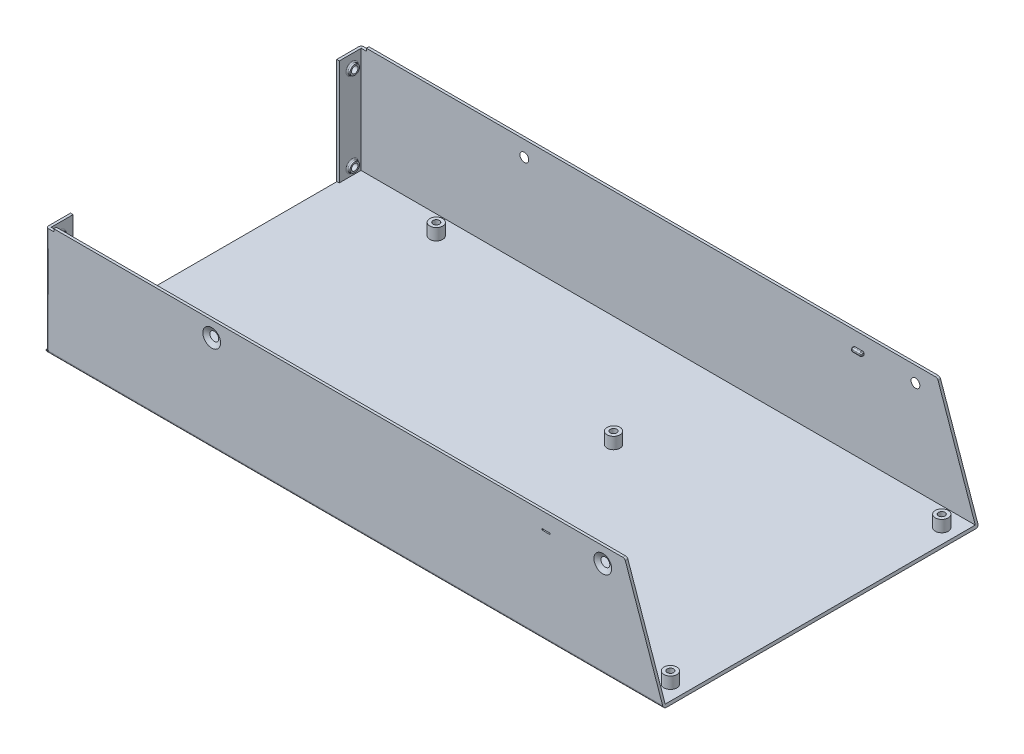
from build123d import *

# Parameters (mm, degrees)
BOSS_EXTRUDE1_DEPTH                 = 239
CUT_EXTRUDE1_REACH                  = 271.197
CUT_EXTRUDE2_REACH                  = 271.197
SKETCH3_W                           = 3
SKETCH3_H                           = 1
F_3_4_3_4_DIAMETER_HOLE1_AT_2_COUNT = 2
F_3_4_3_4_DIAMETER_HOLE1_AT_2_PITCH = 151.37
DRAFT5_ANGLE                        = -60
DRAFT7_ANGLE                        = -60
SKETCH6_W                           = 4
SKETCH6_H                           = 1.5
BOSS_EXTRUDE2_DEPTH                 = 2
SKETCH7_W                           = 3
SKETCH7_H                           = 0.5
CUT_EXTRUDE3_DEPTH                  = 1
FILLET1_R                           = 0.5
DRAFT8_ANGLE                        = -60
DRAFT9_ANGLE                        = -60
FILLET3_R                           = 0.5
SKETCH8_W                           = 1
SKETCH8_H                           = 41
BOSS_EXTRUDE3_DEPTH                 = 8.5
SKETCH9_W                           = 9.5
SKETCH9_H                           = 0.1
CUT_EXTRUDE4_DEPTH                  = 1
SKETCH10_R                          = 2
BOSS_EXTRUDE4_DEPTH                 = 1
M3X0_5_TAPPED_HOLE1_AT_2_COUNT      = 2
M3X0_5_TAPPED_HOLE1_AT_2_PITCH      = 32.65
DRAFT11_ANGLE                       = 10
FILLET5_R                           = 0.5
DRAFT12_ANGLE                       = 10
FILLET6_R                           = 0.5
DRAFT11_OF_MIRROR4_2_ANGLE          = 10
FILLET5_OF_MIRROR4_R                = 0.5
DRAFT12_OF_MIRROR4_2_ANGLE          = 10
FILLET6_OF_MIRROR4_R                = 0.5
FILLET7_R                           = 1
FILLET9_R                           = 1
SKETCH13_R                          = 2.5
BOSS_EXTRUDE5_DEPTH                 = 4.5
M3X0_5_TAPPED_HOLE2_D               = 2.5
M3X0_5_TAPPED_HOLE2_DEPTH           = 4.5
M3X0_5_TAPPED_HOLE2_TIP             = 0.751075774
FILLET10_R                          = 1


# Some blends are built 0.0001 mm under size
with BuildPart() as part:
    # Sketch1 → Boss-Extrude1 (new body)
    with BuildSketch(Plane(origin=(0, 0, 0), x_dir=(0, 0, -1), z_dir=(1, 0, 0))):
        Polygon((-60, -20.5), (-60, 21.5), (-61, 21.5), (-61, -21.5), (61, -21.5), (61, 21.5), (60, 21.5), (60, -20.5), align=None)
    extrude(amount=BOSS_EXTRUDE1_DEPTH)

    # Cut-Extrude1: up to this face of the body (flat: up to its plane)
    cut_extrude1_end = Plane(part.part.faces().sort_by_distance((119.5, 0, -61))[0])
    # Sketch2 → Cut-Extrude1 (cut, up to the picked face)
    with BuildSketch(Plane.XY.offset(61), mode=Mode.PRIVATE) as cut_extrude1_sk1:
        Polygon((239, -21.5), (223.99, 21.5), (239, 21.5), align=None)
    cut_extrude1_tool1 = split(extrude(cut_extrude1_sk1.sketch, amount=-CUT_EXTRUDE1_REACH, mode=Mode.PRIVATE), bisect_by=cut_extrude1_end, keep=Keep.BOTH, mode=Mode.PRIVATE)
    add(cut_extrude1_tool1.solids().sort_by(Axis((233.996667, 7.166667, 61), (0, 0, -1)))[0], mode=Mode.SUBTRACT)

    # Cut-Extrude2: up to this face of the body (flat: up to its plane)
    cut_extrude2_end = Plane(part.part.faces().sort_by_distance((115.78805165, -0.232341231, -61))[0])
    # Sketch3 → Cut-Extrude2 (cut, up to the picked face)
    with BuildSketch(Plane.XY.offset(61), mode=Mode.PRIVATE) as cut_extrude2_sk1:
        with Locations((1.5, 21)):
            Rectangle(SKETCH3_W, SKETCH3_H)
    cut_extrude2_tool1 = split(extrude(cut_extrude2_sk1.sketch, amount=-CUT_EXTRUDE2_REACH, mode=Mode.PRIVATE), bisect_by=cut_extrude2_end, keep=Keep.BOTH, mode=Mode.PRIVATE)
    add(cut_extrude2_tool1.solids().sort_by(Axis((1.5, 21, 61), (0, 0, -1)))[0], mode=Mode.SUBTRACT)

    # Sketch4 → Ø3.4 (3.4) Diameter Hole1 (revolve, cut)
    with BuildSketch(Plane(origin=(64.13, 15.5, 61), x_dir=(0, -1, 0), z_dir=(1, 0, 0))):
        Polygon((0, 0), (0, 2.821463052), (1.7, 1.8), (1.7, 0), align=None)
    f_3_4_3_4_diameter_hole1 = revolve(axis=Axis((64.13, 15.5, 67.35), (0, 0, -1)), mode=Mode.SUBTRACT)

    # Ø3.4 (3.4) Diameter Hole1 at 2: Ø3.4 (3.4) Diameter Hole1 ×2
    with Locations(*[(i * F_3_4_3_4_DIAMETER_HOLE1_AT_2_PITCH, 0, 0) for i in range(1, F_3_4_3_4_DIAMETER_HOLE1_AT_2_COUNT)]):
        add(f_3_4_3_4_diameter_hole1, mode=Mode.SUBTRACT)

    # Draft5
    draft5_faces = [part.faces().sort_by_distance(p)[0] for p in [
        (64.13, 17.2, 60.5),
    ]]
    draft(draft5_faces, Plane(origin=(239, -20.5, 60), x_dir=(-1, 0, 0), z_dir=(0, 0, -1)), DRAFT5_ANGLE)

    # Draft7
    draft7_faces = [part.faces().sort_by_distance(p)[0] for p in [
        (215.5, 17.2, 60.5),
    ]]
    draft(draft7_faces, Plane(origin=(239, -20.5, 60), x_dir=(-1, 0, 0), z_dir=(0, 0, -1)), DRAFT7_ANGLE)

    # Sketch6 → Boss-Extrude2 (add)
    with BuildSketch(Plane.XY.offset(61)):
        with Locations((193.53, 15.25)):
            Rectangle(SKETCH6_W, SKETCH6_H)
    boss_extrude2 = extrude(amount=-BOSS_EXTRUDE2_DEPTH)

    # Sketch7 → Cut-Extrude3 (cut)
    with BuildSketch(Plane.XY.offset(61)):
        with Locations((193.53, 15.25)):
            Rectangle(SKETCH7_W, SKETCH7_H)
    cut_extrude3 = extrude(amount=-CUT_EXTRUDE3_DEPTH, mode=Mode.SUBTRACT)

    # Fillet1
    fillet1_edges = [part.edges().sort_by_distance(p)[0] for p in [
        (195.53, 15.25, 59),
        (195.53, 16, 59.5),
        (193.53, 14.5, 59),
        (195.53, 14.5, 59.5),
        (191.53, 15.25, 59),
        (191.53, 14.5, 59.5),
        (193.53, 16, 59),
        (191.53, 16, 59.5),
    ]]
    fillet(fillet1_edges, radius=FILLET1_R)

    # Mirror1: Ø3.4 (3.4) Diameter Hole1, Boss-Extrude2, Cut-Extrude3 across plane
    add(f_3_4_3_4_diameter_hole1.mirror(Plane.XY), mode=Mode.SUBTRACT)
    add(boss_extrude2.mirror(Plane.XY))
    add(cut_extrude3.mirror(Plane.XY), mode=Mode.SUBTRACT)

    # Mirror1 copy 1 sketch → Mirror1 copy 1 (revolve, cut)
    with BuildSketch(Plane(origin=(215.5, 15.5, -61), x_dir=(0, -1, 0), z_dir=(1, 0, 0))):
        Polygon((0, 0), (0, -2.821463052), (1.7, -1.8), (1.7, 0), align=None)
    revolve(axis=Axis((215.5, 15.5, -67.35), (0, 0, -1)), mode=Mode.SUBTRACT)

    # Draft8
    draft8_faces = [part.faces().sort_by_distance(p)[0] for p in [
        (215.5, 17.2, -60.5),
    ]]
    draft(draft8_faces, Plane(origin=(239, -20.5, -60), x_dir=(0, 1, 0), z_dir=(0, 0, 1)), DRAFT8_ANGLE)

    # Draft9
    draft9_faces = [part.faces().sort_by_distance(p)[0] for p in [
        (64.13, 17.2, -60.5),
    ]]
    draft(draft9_faces, Plane(origin=(239, -20.5, -60), x_dir=(0, 1, 0), z_dir=(0, 0, 1)), DRAFT9_ANGLE)

    # Fillet3
    fillet3_edges = [part.edges().sort_by_distance(p)[0] for p in [
        (195.53, 14.5, -59.5),
        (195.53, 16, -59.5),
        (191.53, 16, -59.5),
        (191.53, 14.5, -59.5),
        (195.53, 15.25, -59),
        (193.53, 16, -59),
        (191.53, 15.25, -59),
        (193.53, 14.5, -59),
    ]]
    fillet(fillet3_edges, radius=FILLET3_R)

    # Sketch8 → Boss-Extrude3 (add)
    with BuildSketch(Plane.XY.offset(-60)):
        with Locations((0.5, 0)):
            Rectangle(SKETCH8_W, SKETCH8_H)
    boss_extrude3 = extrude(amount=BOSS_EXTRUDE3_DEPTH)

    # Sketch9 → Cut-Extrude4 (cut)
    with BuildSketch(Plane.ZY):
        with Locations((-56.25, -20.45)):
            Rectangle(SKETCH9_W, SKETCH9_H)
    cut_extrude4 = extrude(amount=-CUT_EXTRUDE4_DEPTH, mode=Mode.SUBTRACT)

    # Sketch10 → Boss-Extrude4 (add)
    with BuildSketch(Plane(origin=(1, 0, 0), x_dir=(0, 0, -1), z_dir=(1, 0, 0))):
        with Locations(Location((56.5, 15.5, 0), (0, 0, 270))):
            Circle(SKETCH10_R)
        with Locations(Location((56.5, -17.15, 0), (0, 0, 270))):
            Circle(SKETCH10_R)
    boss_extrude4 = extrude(amount=BOSS_EXTRUDE4_DEPTH)

    # Sketch11 → M3x0.5 Tapped Hole1 (revolve, cut)
    with BuildSketch(Plane(origin=(2, 15.5, -56.5), x_dir=(0, 0, -1), z_dir=(0, 1, 0))):
        Polygon((0, 0), (0, 2.751075774), (1.25, 2), (1.25, 0), align=None)
    m3x0_5_tapped_hole1 = revolve(axis=Axis((8.35, 15.5, -56.5), (-1, 0, 0)), mode=Mode.SUBTRACT)

    # M3x0.5 Tapped Hole1 at 2: M3x0.5 Tapped Hole1 ×2
    with Locations(*[(0, -i * M3X0_5_TAPPED_HOLE1_AT_2_PITCH, 0) for i in range(1, M3X0_5_TAPPED_HOLE1_AT_2_COUNT)]):
        add(m3x0_5_tapped_hole1, mode=Mode.SUBTRACT)

    # Draft11
    draft11_faces = [part.faces().sort_by_distance(p)[0] for p in [
        (1.5, 17.5, -56.5),
    ]]
    draft(draft11_faces, Plane(origin=(1, 20.5, -51.5), x_dir=(0, 1, 0), z_dir=(1, 0, 0)), DRAFT11_ANGLE)

    # Fillet5
    fillet5_edges = [part.edges().sort_by_distance(p)[0] for p in [
        (1, 17.5, -56.5),
    ]]
    fillet(fillet5_edges, radius=FILLET5_R)

    # Draft12
    draft12_faces = [part.faces().sort_by_distance(p)[0] for p in [
        (1.5, -15.15, -56.5),
    ]]
    draft(draft12_faces, Plane(origin=(1, 20.5, -51.5), x_dir=(0, 1, 0), z_dir=(1, 0, 0)), DRAFT12_ANGLE)

    # Fillet6
    fillet6_edges = [part.edges().sort_by_distance(p)[0] for p in [
        (1, -15.15, -56.5),
    ]]
    fillet(fillet6_edges, radius=FILLET6_R)

    # Mirror4: Boss-Extrude3, Cut-Extrude4, Boss-Extrude4, M3x0.5 Tapped Hole1 across plane
    add(boss_extrude3.mirror(Plane.XY))
    add(cut_extrude4.mirror(Plane.XY), mode=Mode.SUBTRACT)
    add(boss_extrude4.mirror(Plane.XY))
    add(m3x0_5_tapped_hole1.mirror(Plane.XY), mode=Mode.SUBTRACT)

    # Mirror4 copy 1 sketch → Mirror4 copy 1 (revolve, cut)
    with BuildSketch(Plane(origin=(2, -17.15, 56.5), x_dir=(0, 0, 1), z_dir=(0, 1, 0))):
        Polygon((0, 0), (0, -2.751075774), (1.25, -2), (1.25, 0), align=None)
    revolve(axis=Axis((8.35, -17.15, 56.5), (1, 0, 0)), mode=Mode.SUBTRACT)

    # Draft11 of Mirror4 2
    draft11_of_mirror4_2_faces = [part.faces().sort_by_distance(p)[0] for p in [
        (1.5, 17.5, 56.5),
    ]]
    draft(draft11_of_mirror4_2_faces, Plane(origin=(1, 20.5, 51.5), x_dir=(0, 1, 0), z_dir=(1, 0, 0)), DRAFT11_OF_MIRROR4_2_ANGLE)

    # Fillet5 of Mirror4
    fillet5_of_mirror4_edges = [part.edges().sort_by_distance(p)[0] for p in [
        (1, 17.5, 56.5),
    ]]
    fillet(fillet5_of_mirror4_edges, radius=FILLET5_OF_MIRROR4_R)

    # Draft12 of Mirror4 2
    draft12_of_mirror4_2_faces = [part.faces().sort_by_distance(p)[0] for p in [
        (1.5, -15.15, 56.5),
    ]]
    draft(draft12_of_mirror4_2_faces, Plane(origin=(1, 20.5, 51.5), x_dir=(0, 1, 0), z_dir=(1, 0, 0)), DRAFT12_OF_MIRROR4_2_ANGLE)

    # Fillet6 of Mirror4
    fillet6_of_mirror4_edges = [part.edges().sort_by_distance(p)[0] for p in [
        (1, -15.15, 56.5),
    ]]
    fillet(fillet6_of_mirror4_edges, radius=FILLET6_OF_MIRROR4_R)

    # Fillet7
    # the kernel refuses this fillet: 1 mm, written as the material it takes off along each edge
    with BuildSketch(Plane(origin=(-2.5, -21.5, -61), x_dir=(0, 1, 0), z_dir=(1, 0, 0))) as fillet7_piece_1:
        with BuildLine():
            CenterArc((FILLET7_R, FILLET7_R), FILLET7_R, 180, 90)
            Line((0, FILLET7_R), (0, 0))
            Line((0, 0), (FILLET7_R, 0))
        make_face()
    extrude(amount=244, mode=Mode.SUBTRACT)
    with BuildSketch(Plane(origin=(0, -20.4, -61), x_dir=(1, 0, 0), z_dir=(0, 1, 0))) as fillet7_piece_2:
        with BuildLine():
            CenterArc((FILLET7_R, -FILLET7_R), FILLET7_R, 90, 90)
            Line((0, -FILLET7_R), (0, 0))
            Line((0, 0), (FILLET7_R, 0))
        make_face()
    extrude(amount=43.4, mode=Mode.SUBTRACT)
    with BuildSketch(Plane(origin=(0, -24, -61), x_dir=(1, 0, 0), z_dir=(0, 1, 0))) as fillet7_piece_3_section:
        with BuildLine():
            CenterArc((FILLET7_R, -FILLET7_R), FILLET7_R, 90, 90)
            Line((0, -FILLET7_R), (0, 0))
            Line((0, 0), (FILLET7_R, 0))
        make_face()
    fillet7_piece_3 = extrude(amount=6, mode=Mode.PRIVATE)
    fillet7_piece_3 = split(fillet7_piece_3, bisect_by=Plane(origin=(0.223367939, -20.4, -60.776632061), z_dir=(0, 1, 0)), keep=Keep.TOP, mode=Mode.PRIVATE)
    add(fillet7_piece_3, mode=Mode.SUBTRACT)

    # Fillet9
    fillet9_edges = [part.edges().sort_by_distance(p)[0] for p in [
        (119.5, -21.5, 61),
        (0, 0.05, 61),
    ]]
    fillet(fillet9_edges, radius=FILLET9_R - 0.0001)  # a hair under: the kernel refuses the full size

    # Sketch13 → Boss-Extrude5 (add)
    with BuildSketch(Plane(origin=(0, -20.5, 0), x_dir=(1, 0, 0), z_dir=(0, 1, 0))):
        with Locations(Location((37.37, 52.68, 0), (0, 0, 90))):
            Circle(SKETCH13_R)
        with Locations(Location((233, 52.68, 0), (0, 0, 90))):
            Circle(SKETCH13_R)
        with Locations(Location((233, -52.32, 0), (0, 0, 90))):
            Circle(SKETCH13_R)
        with Locations(Location((12, -52.32, 0), (0, 0, 90))):
            Circle(SKETCH13_R)
        with Locations(Location((141.65, 17.01, 0), (0, 0, 90))):
            Circle(SKETCH13_R)
    extrude(amount=BOSS_EXTRUDE5_DEPTH)

    # M3x0.5 Tapped Hole2
    with Locations(Plane(origin=(0, -16, 0), x_dir=(1, 0, 0), z_dir=(0, 1, 0))):
        with Locations((37.37, 52.68), (233, 52.68), (141.65, 17.01), (12, -52.32), (233, -52.32)):
            Hole(M3X0_5_TAPPED_HOLE2_D / 2, depth=M3X0_5_TAPPED_HOLE2_DEPTH)
            with Locations((0, 0, -(M3X0_5_TAPPED_HOLE2_DEPTH + M3X0_5_TAPPED_HOLE2_TIP / 2))):  # 118° drill point
                Cone(0, M3X0_5_TAPPED_HOLE2_D / 2, M3X0_5_TAPPED_HOLE2_TIP, mode=Mode.SUBTRACT)

    # Fillet10
    fillet10_edges = [part.edges().sort_by_distance(p)[0] for p in [
        (223.99, 21.5, -60.5),
        (223.99, 21.5, 60.5),
    ]]
    fillet(fillet10_edges, radius=FILLET10_R)


solid = part.part
